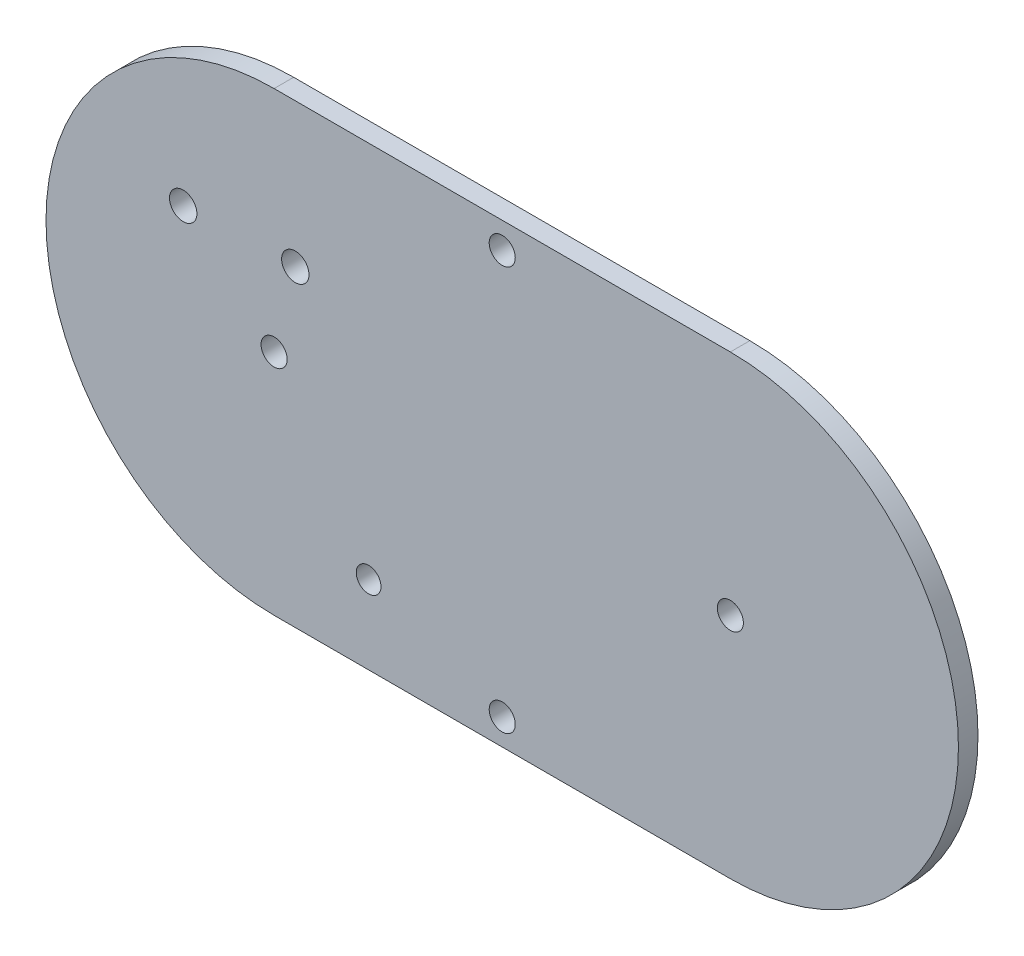
from build123d import *

# Parameters (mm, degrees)
SKETCH1_R           = 2
SKETCH1_R_2         = 2.099997394
SKETCH1_R_3         = 2.100000418
SKETCH1_R_4         = 1.9
BOSS_EXTRUDE1_DEPTH = 3


with BuildPart() as part:
    # Sketch1 → Boss-Extrude1 (new body)
    with BuildSketch(Plane.XY):
        with BuildLine():
            Line((243.514566495, 346.287321237), (313.514566495, 346.287321237))
            ThreePointArc((313.514566495, 346.287321237), (348.514566495, 311.287321237), (313.514566495, 276.287321237))
            Line((313.514566495, 276.287321237), (243.514566495, 276.287321237))
            ThreePointArc((243.514566495, 276.287321237), (208.514566495, 311.287321237), (243.514566495, 346.287321237))
        make_face()
        with Locations((243.514566495, 311.287321237)):
            Circle(SKETCH1_R, mode=Mode.SUBTRACT)
        with Locations((313.514566495, 311.287321237)):
            Circle(SKETCH1_R, mode=Mode.SUBTRACT)
        with Locations((246.764562225, 324.225588056)):
            Circle(SKETCH1_R_2, mode=Mode.SUBTRACT)
        with Locations((229.564568056, 323.725595013)):
            Circle(SKETCH1_R_3, mode=Mode.SUBTRACT)
        with Locations((278.514566495, 342.287321237)):
            Circle(SKETCH1_R, mode=Mode.SUBTRACT)
        with Locations((278.514566495, 280.287321237)):
            Circle(SKETCH1_R, mode=Mode.SUBTRACT)
        with Locations((258.014566495, 288.287321237)):
            Circle(SKETCH1_R_4, mode=Mode.SUBTRACT)
    extrude(amount=BOSS_EXTRUDE1_DEPTH)


solid = part.part
